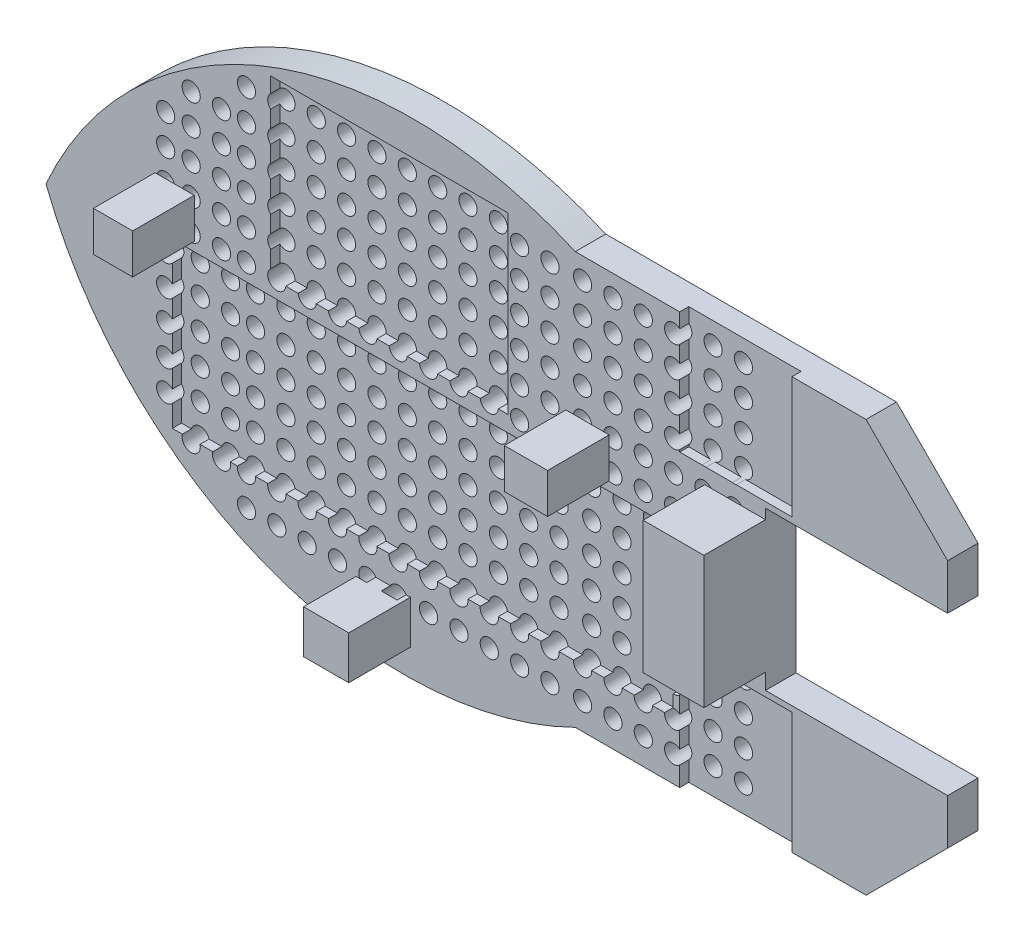
from build123d import *

# Parameters (mm, degrees)
BOSS_EXTRUDE1_DEPTH      = 10
BOSS_EXTRUDE1_DEPTH_BACK = 0.01
SKETCH3_W                = 37
SKETCH3_H                = 40
CUT_EXTRUDE1_DEPTH       = 3
SKETCH5_W                = 37
SKETCH5_H                = 40
CUT_EXTRUDE3_DEPTH       = 3
SKETCH7_W                = 165
SKETCH7_H                = 54
CUT_EXTRUDE4_DEPTH       = 3
SKETCH8_W                = 78.2
SKETCH8_H                = 57.5
CUT_EXTRUDE5_DEPTH       = 3
SKETCH9_W                = 12.924332112
SKETCH9_H                = 13.143388588
SKETCH9_W_2              = 14.238670971
SKETCH9_W_3              = 14.8958404
SKETCH9_H_2              = 14.23867097
BOSS_EXTRUDE2_DEPTH      = 20.3
SKETCH11_R               = 3
CUT_EXTRUDE12_DEPTH      = 13
CUT_EXTRUDE13_REACH      = 254.32
SKETCH12_R               = 3
CUT_EXTRUDE14_REACH      = 254.32
SKETCH13_R               = 3
SKETCH14_R               = 3
CUT_EXTRUDE16_DEPTH      = 10.01
SKETCH15_W               = 20
SKETCH15_H               = 43.5
BOSS_EXTRUDE3_DEPTH      = 20.3


with BuildPart() as part:
    # Sketch1 → Boss-Extrude1 (new, two sides: drawn at the far end of the back side and taken through both)
    with BuildSketch(Plane.XY.offset(-BOSS_EXTRUDE1_DEPTH_BACK)):
        with BuildLine():
            Line((0, 0), (0, 26))
            Line((0, 26), (60, 26))
            Line((60, 26), (60, 41))
            Line((60, 41), (33.129942315, 67.870057685))
            Line((33.129942315, 67.870057685), (-62.646462349, 67.870057685))
            ThreePointArc((-62.646462349, 67.870057685), (-163.893113975, 70.05043462), (-237.027067228, 0))
            ThreePointArc((-237.027067228, 0), (-164.807132047, -72.398849072), (-62.646462349, -67.870057685))
            Line((-62.646462349, -67.870057685), (33.129942315, -67.870057685))
            Line((33.129942315, -67.870057685), (60, -41))
            Line((60, -41), (60, -26))
            Line((60, -26), (0, -26))
            Line((0, -26), (0, 0))
        make_face()
    extrude(amount=BOSS_EXTRUDE1_DEPTH + BOSS_EXTRUDE1_DEPTH_BACK)

    # Sketch3 → Cut-Extrude1 (cut)
    with BuildSketch(Plane.XY.offset(10)):
        with Locations((-9.773002586, 47.870057685)):
            Rectangle(SKETCH3_W, SKETCH3_H)
    extrude(amount=-CUT_EXTRUDE1_DEPTH, mode=Mode.SUBTRACT)

    # Sketch5 → Cut-Extrude3 (cut)
    with BuildSketch(Plane.XY.offset(10)):
        with Locations((-9.773002586, -47.870057685)):
            Rectangle(SKETCH5_W, SKETCH5_H)
    extrude(amount=-CUT_EXTRUDE3_DEPTH, mode=Mode.SUBTRACT)

    # Sketch7 → Cut-Extrude4 (cut)
    with BuildSketch(Plane.XY.offset(10)):
        with Locations((-112.913094129, -21.943838981)):
            Rectangle(SKETCH7_W, SKETCH7_H)
    extrude(amount=-CUT_EXTRUDE4_DEPTH, mode=Mode.SUBTRACT)

    # Sketch8 → Cut-Extrude5 (cut)
    with BuildSketch(Plane.XY.offset(10)):
        with Locations((-123.892735612, 39.063262975)):
            Rectangle(SKETCH8_W, SKETCH8_H)
    extrude(amount=-CUT_EXTRUDE5_DEPTH, mode=Mode.SUBTRACT)

    # Sketch9 → Boss-Extrude2 (add)
    with BuildSketch(Plane.XY.offset(10)):
        with Locations((-194.646396461, 14.582539194)):
            Rectangle(SKETCH9_W, SKETCH9_H)
        with Locations((-58.612324577, 14.582539194)):
            Rectangle(SKETCH9_W_2, SKETCH9_H)
        with Locations((-124.438795754, -65.044490001)):
            Rectangle(SKETCH9_W_3, SKETCH9_H_2)
    extrude(amount=BOSS_EXTRUDE2_DEPTH)

    # Sketch11 → Cut-Extrude12 (cut)
    with BuildSketch(Plane(origin=(0, 0, -0.01), x_dir=(-1, 0, 0), z_dir=(0, 0, -1))):
        with Locations((70.989015497, 60.584399251)):
            Circle(SKETCH11_R)
        with Locations((80.989015497, 60.584399251)):
            Circle(SKETCH11_R)
        with Locations((90.989015497, 60.584399251)):
            Circle(SKETCH11_R)
        with Locations((100.989015497, 60.584399251)):
            Circle(SKETCH11_R)
        with Locations((110.989015497, 60.584399251)):
            Circle(SKETCH11_R)
        with Locations((120.989015497, 60.584399251)):
            Circle(SKETCH11_R)
        with Locations((130.989015497, 60.584399251)):
            Circle(SKETCH11_R)
        with Locations((140.989015497, 60.584399251)):
            Circle(SKETCH11_R)
        with Locations((150.989015497, 60.584399251)):
            Circle(SKETCH11_R)
        with Locations((160.989015497, 60.584399251)):
            Circle(SKETCH11_R)
        with Locations((170.989015497, 60.584399251)):
            Circle(SKETCH11_R)
        with Locations((80.989015497, 50.584399251)):
            Circle(SKETCH11_R)
        with Locations((90.989015497, 50.584399251)):
            Circle(SKETCH11_R)
        with Locations((100.989015497, 50.584399251)):
            Circle(SKETCH11_R)
        with Locations((110.989015497, 50.584399251)):
            Circle(SKETCH11_R)
        with Locations((120.989015497, 50.584399251)):
            Circle(SKETCH11_R)
        with Locations((130.989015497, 50.584399251)):
            Circle(SKETCH11_R)
        with Locations((140.989015497, 50.584399251)):
            Circle(SKETCH11_R)
        with Locations((150.989015497, 50.584399251)):
            Circle(SKETCH11_R)
        with Locations((160.989015497, 50.584399251)):
            Circle(SKETCH11_R)
        with Locations((170.989015497, 50.584399251)):
            Circle(SKETCH11_R)
        with Locations((80.989015497, 40.584399251)):
            Circle(SKETCH11_R)
        with Locations((90.989015497, 40.584399251)):
            Circle(SKETCH11_R)
        with Locations((100.989015497, 40.584399251)):
            Circle(SKETCH11_R)
        with Locations((110.989015497, 40.584399251)):
            Circle(SKETCH11_R)
        with Locations((120.989015497, 40.584399251)):
            Circle(SKETCH11_R)
        with Locations((130.989015497, 40.584399251)):
            Circle(SKETCH11_R)
        with Locations((140.989015497, 40.584399251)):
            Circle(SKETCH11_R)
        with Locations((150.989015497, 40.584399251)):
            Circle(SKETCH11_R)
        with Locations((160.989015497, 40.584399251)):
            Circle(SKETCH11_R)
        with Locations((170.989015497, 40.584399251)):
            Circle(SKETCH11_R)
        with Locations((80.989015497, 30.584399251)):
            Circle(SKETCH11_R)
        with Locations((90.989015497, 30.584399251)):
            Circle(SKETCH11_R)
        with Locations((100.989015497, 30.584399251)):
            Circle(SKETCH11_R)
        with Locations((110.989015497, 30.584399251)):
            Circle(SKETCH11_R)
        with Locations((120.989015497, 30.584399251)):
            Circle(SKETCH11_R)
        with Locations((130.989015497, 30.584399251)):
            Circle(SKETCH11_R)
        with Locations((140.989015497, 30.584399251)):
            Circle(SKETCH11_R)
        with Locations((150.989015497, 30.584399251)):
            Circle(SKETCH11_R)
        with Locations((160.989015497, 30.584399251)):
            Circle(SKETCH11_R)
        with Locations((170.989015497, 30.584399251)):
            Circle(SKETCH11_R)
        with Locations((80.989015497, 20.584399251)):
            Circle(SKETCH11_R)
        with Locations((90.989015497, 20.584399251)):
            Circle(SKETCH11_R)
        with Locations((100.989015497, 20.584399251)):
            Circle(SKETCH11_R)
        with Locations((110.989015497, 20.584399251)):
            Circle(SKETCH11_R)
        with Locations((120.989015497, 20.584399251)):
            Circle(SKETCH11_R)
        with Locations((130.989015497, 20.584399251)):
            Circle(SKETCH11_R)
        with Locations((140.989015497, 20.584399251)):
            Circle(SKETCH11_R)
        with Locations((150.989015497, 20.584399251)):
            Circle(SKETCH11_R)
        with Locations((160.989015497, 20.584399251)):
            Circle(SKETCH11_R)
        with Locations((170.989015497, 20.584399251)):
            Circle(SKETCH11_R)
        with Locations((80.989015497, 10.584399251)):
            Circle(SKETCH11_R)
        with Locations((90.989015497, 10.584399251)):
            Circle(SKETCH11_R)
        with Locations((100.989015497, 10.584399251)):
            Circle(SKETCH11_R)
        with Locations((110.989015497, 10.584399251)):
            Circle(SKETCH11_R)
        with Locations((120.989015497, 10.584399251)):
            Circle(SKETCH11_R)
        with Locations((130.989015497, 10.584399251)):
            Circle(SKETCH11_R)
        with Locations((140.989015497, 10.584399251)):
            Circle(SKETCH11_R)
        with Locations((150.989015497, 10.584399251)):
            Circle(SKETCH11_R)
        with Locations((160.989015497, 10.584399251)):
            Circle(SKETCH11_R)
        with Locations((170.989015497, 10.584399251)):
            Circle(SKETCH11_R)
        with Locations((80.989015497, 0.584399251)):
            Circle(SKETCH11_R)
        with Locations((90.989015497, 0.584399251)):
            Circle(SKETCH11_R)
        with Locations((100.989015497, 0.584399251)):
            Circle(SKETCH11_R)
        with Locations((110.989015497, 0.584399251)):
            Circle(SKETCH11_R)
        with Locations((120.989015497, 0.584399251)):
            Circle(SKETCH11_R)
        with Locations((130.989015497, 0.584399251)):
            Circle(SKETCH11_R)
        with Locations((140.989015497, 0.584399251)):
            Circle(SKETCH11_R)
        with Locations((150.989015497, 0.584399251)):
            Circle(SKETCH11_R)
        with Locations((160.989015497, 0.584399251)):
            Circle(SKETCH11_R)
        with Locations((170.989015497, 0.584399251)):
            Circle(SKETCH11_R)
        with Locations((80.989015497, -9.415600749)):
            Circle(SKETCH11_R)
        with Locations((90.989015497, -9.415600749)):
            Circle(SKETCH11_R)
        with Locations((100.989015497, -9.415600749)):
            Circle(SKETCH11_R)
        with Locations((110.989015497, -9.415600749)):
            Circle(SKETCH11_R)
        with Locations((120.989015497, -9.415600749)):
            Circle(SKETCH11_R)
        with Locations((130.989015497, -9.415600749)):
            Circle(SKETCH11_R)
        with Locations((140.989015497, -9.415600749)):
            Circle(SKETCH11_R)
        with Locations((150.989015497, -9.415600749)):
            Circle(SKETCH11_R)
        with Locations((160.989015497, -9.415600749)):
            Circle(SKETCH11_R)
        with Locations((170.989015497, -9.415600749)):
            Circle(SKETCH11_R)
        with Locations((80.989015497, -19.415600749)):
            Circle(SKETCH11_R)
        with Locations((90.989015497, -19.415600749)):
            Circle(SKETCH11_R)
        with Locations((100.989015497, -19.415600749)):
            Circle(SKETCH11_R)
        with Locations((110.989015497, -19.415600749)):
            Circle(SKETCH11_R)
        with Locations((120.989015497, -19.415600749)):
            Circle(SKETCH11_R)
        with Locations((130.989015497, -19.415600749)):
            Circle(SKETCH11_R)
        with Locations((140.989015497, -19.415600749)):
            Circle(SKETCH11_R)
        with Locations((150.989015497, -19.415600749)):
            Circle(SKETCH11_R)
        with Locations((160.989015497, -19.415600749)):
            Circle(SKETCH11_R)
        with Locations((170.989015497, -19.415600749)):
            Circle(SKETCH11_R)
        with Locations((80.989015497, -29.415600749)):
            Circle(SKETCH11_R)
        with Locations((90.989015497, -29.415600749)):
            Circle(SKETCH11_R)
        with Locations((100.989015497, -29.415600749)):
            Circle(SKETCH11_R)
        with Locations((110.989015497, -29.415600749)):
            Circle(SKETCH11_R)
        with Locations((120.989015497, -29.415600749)):
            Circle(SKETCH11_R)
        with Locations((130.989015497, -29.415600749)):
            Circle(SKETCH11_R)
        with Locations((140.989015497, -29.415600749)):
            Circle(SKETCH11_R)
        with Locations((150.989015497, -29.415600749)):
            Circle(SKETCH11_R)
        with Locations((160.989015497, -29.415600749)):
            Circle(SKETCH11_R)
        with Locations((170.989015497, -29.415600749)):
            Circle(SKETCH11_R)
        with Locations((80.989015497, -39.415600749)):
            Circle(SKETCH11_R)
        with Locations((90.989015497, -39.415600749)):
            Circle(SKETCH11_R)
        with Locations((100.989015497, -39.415600749)):
            Circle(SKETCH11_R)
        with Locations((110.989015497, -39.415600749)):
            Circle(SKETCH11_R)
        with Locations((120.989015497, -39.415600749)):
            Circle(SKETCH11_R)
        with Locations((130.989015497, -39.415600749)):
            Circle(SKETCH11_R)
        with Locations((140.989015497, -39.415600749)):
            Circle(SKETCH11_R)
        with Locations((150.989015497, -39.415600749)):
            Circle(SKETCH11_R)
        with Locations((160.989015497, -39.415600749)):
            Circle(SKETCH11_R)
        with Locations((170.989015497, -39.415600749)):
            Circle(SKETCH11_R)
        with Locations((80.989015497, -49.415600749)):
            Circle(SKETCH11_R)
        with Locations((90.989015497, -49.415600749)):
            Circle(SKETCH11_R)
        with Locations((100.989015497, -49.415600749)):
            Circle(SKETCH11_R)
        with Locations((110.989015497, -49.415600749)):
            Circle(SKETCH11_R)
        with Locations((120.989015497, -49.415600749)):
            Circle(SKETCH11_R)
        with Locations((130.989015497, -49.415600749)):
            Circle(SKETCH11_R)
        with Locations((140.989015497, -49.415600749)):
            Circle(SKETCH11_R)
        with Locations((150.989015497, -49.415600749)):
            Circle(SKETCH11_R)
        with Locations((160.989015497, -49.415600749)):
            Circle(SKETCH11_R)
        with Locations((170.989015497, -49.415600749)):
            Circle(SKETCH11_R)
        with Locations((80.989015497, -59.415600749)):
            Circle(SKETCH11_R)
        with Locations((90.989015497, -59.415600749)):
            Circle(SKETCH11_R)
        with Locations((100.989015497, -59.415600749)):
            Circle(SKETCH11_R)
        with Locations((110.989015497, -59.415600749)):
            Circle(SKETCH11_R)
        with Locations((120.989015497, -59.415600749)):
            Circle(SKETCH11_R)
        with Locations((130.989015497, -59.415600749)):
            Circle(SKETCH11_R)
        with Locations((140.989015497, -59.415600749)):
            Circle(SKETCH11_R)
        with Locations((150.989015497, -59.415600749)):
            Circle(SKETCH11_R)
        with Locations((160.989015497, -59.415600749)):
            Circle(SKETCH11_R)
        with Locations((170.989015497, -59.415600749)):
            Circle(SKETCH11_R)
        with Locations((70.989015497, 50.584399251)):
            Circle(SKETCH11_R)
        with Locations((70.989015497, 40.584399251)):
            Circle(SKETCH11_R)
        with Locations((70.989015497, 30.584399251)):
            Circle(SKETCH11_R)
        with Locations((70.989015497, 20.584399251)):
            Circle(SKETCH11_R)
        with Locations((70.989015497, 10.584399251)):
            Circle(SKETCH11_R)
        with Locations((70.989015497, 0.584399251)):
            Circle(SKETCH11_R)
        with Locations((70.989015497, -9.415600749)):
            Circle(SKETCH11_R)
        with Locations((70.989015497, -19.415600749)):
            Circle(SKETCH11_R)
        with Locations((70.989015497, -29.415600749)):
            Circle(SKETCH11_R)
        with Locations((70.989015497, -39.415600749)):
            Circle(SKETCH11_R)
        with Locations((70.989015497, -49.415600749)):
            Circle(SKETCH11_R)
        with Locations((70.989015497, -59.415600749)):
            Circle(SKETCH11_R)
    extrude(amount=-CUT_EXTRUDE12_DEPTH, mode=Mode.SUBTRACT)

    # Cut-Extrude13: up to this face of the body (flat: up to its plane)
    cut_extrude13_end = Plane(part.part.faces().sort_by_distance((-45.459732468, 64.495853875, 10))[0])
    # Sketch12 → Cut-Extrude13 (cut, up to the picked face)
    with BuildSketch(Plane(origin=(0, 0, -0.01), x_dir=(-1, 0, 0), z_dir=(0, 0, -1)), mode=Mode.PRIVATE) as cut_extrude13_sk1:
        with Locations((179.20291487, 50.26025315)):
            Circle(SKETCH12_R)
    cut_extrude13_tool1 = split(extrude(cut_extrude13_sk1.sketch, amount=-CUT_EXTRUDE13_REACH, mode=Mode.PRIVATE), bisect_by=cut_extrude13_end, keep=Keep.BOTH, mode=Mode.PRIVATE)
    # Sketch12 → Cut-Extrude13 (cut, up to the picked face)
    with BuildSketch(Plane(origin=(0, 0, -0.01), x_dir=(-1, 0, 0), z_dir=(0, 0, -1)), mode=Mode.PRIVATE) as cut_extrude13_sk2:
        with Locations((189.20291487, 50.26025315)):
            Circle(SKETCH12_R)
    cut_extrude13_tool2 = split(extrude(cut_extrude13_sk2.sketch, amount=-CUT_EXTRUDE13_REACH, mode=Mode.PRIVATE), bisect_by=cut_extrude13_end, keep=Keep.BOTH, mode=Mode.PRIVATE)
    # Sketch12 → Cut-Extrude13 (cut, up to the picked face)
    with BuildSketch(Plane(origin=(0, 0, -0.01), x_dir=(-1, 0, 0), z_dir=(0, 0, -1)), mode=Mode.PRIVATE) as cut_extrude13_sk3:
        with Locations((189.20291487, 40.26025315)):
            Circle(SKETCH12_R)
    cut_extrude13_tool3 = split(extrude(cut_extrude13_sk3.sketch, amount=-CUT_EXTRUDE13_REACH, mode=Mode.PRIVATE), bisect_by=cut_extrude13_end, keep=Keep.BOTH, mode=Mode.PRIVATE)
    # Sketch12 → Cut-Extrude13 (cut, up to the picked face)
    with BuildSketch(Plane(origin=(0, 0, -0.01), x_dir=(-1, 0, 0), z_dir=(0, 0, -1)), mode=Mode.PRIVATE) as cut_extrude13_sk4:
        with Locations((189.20291487, 30.26025315)):
            Circle(SKETCH12_R)
    cut_extrude13_tool4 = split(extrude(cut_extrude13_sk4.sketch, amount=-CUT_EXTRUDE13_REACH, mode=Mode.PRIVATE), bisect_by=cut_extrude13_end, keep=Keep.BOTH, mode=Mode.PRIVATE)
    # Sketch12 → Cut-Extrude13 (cut, up to the picked face)
    with BuildSketch(Plane(origin=(0, 0, -0.01), x_dir=(-1, 0, 0), z_dir=(0, 0, -1)), mode=Mode.PRIVATE) as cut_extrude13_sk5:
        with Locations((189.20291487, 20.26025315)):
            Circle(SKETCH12_R)
    cut_extrude13_tool5 = split(extrude(cut_extrude13_sk5.sketch, amount=-CUT_EXTRUDE13_REACH, mode=Mode.PRIVATE), bisect_by=cut_extrude13_end, keep=Keep.BOTH, mode=Mode.PRIVATE)
    # Sketch12 → Cut-Extrude13 (cut, up to the picked face)
    with BuildSketch(Plane(origin=(0, 0, -0.01), x_dir=(-1, 0, 0), z_dir=(0, 0, -1)), mode=Mode.PRIVATE) as cut_extrude13_sk6:
        with Locations((189.20291487, 10.26025315)):
            Circle(SKETCH12_R)
    cut_extrude13_tool6 = split(extrude(cut_extrude13_sk6.sketch, amount=-CUT_EXTRUDE13_REACH, mode=Mode.PRIVATE), bisect_by=cut_extrude13_end, keep=Keep.BOTH, mode=Mode.PRIVATE)
    # Sketch12 → Cut-Extrude13 (cut, up to the picked face)
    with BuildSketch(Plane(origin=(0, 0, -0.01), x_dir=(-1, 0, 0), z_dir=(0, 0, -1)), mode=Mode.PRIVATE) as cut_extrude13_sk7:
        with Locations((189.20291487, 0.26025315)):
            Circle(SKETCH12_R)
    cut_extrude13_tool7 = split(extrude(cut_extrude13_sk7.sketch, amount=-CUT_EXTRUDE13_REACH, mode=Mode.PRIVATE), bisect_by=cut_extrude13_end, keep=Keep.BOTH, mode=Mode.PRIVATE)
    # Sketch12 → Cut-Extrude13 (cut, up to the picked face)
    with BuildSketch(Plane(origin=(0, 0, -0.01), x_dir=(-1, 0, 0), z_dir=(0, 0, -1)), mode=Mode.PRIVATE) as cut_extrude13_sk8:
        with Locations((189.20291487, -9.73974685)):
            Circle(SKETCH12_R)
    cut_extrude13_tool8 = split(extrude(cut_extrude13_sk8.sketch, amount=-CUT_EXTRUDE13_REACH, mode=Mode.PRIVATE), bisect_by=cut_extrude13_end, keep=Keep.BOTH, mode=Mode.PRIVATE)
    # Sketch12 → Cut-Extrude13 (cut, up to the picked face)
    with BuildSketch(Plane(origin=(0, 0, -0.01), x_dir=(-1, 0, 0), z_dir=(0, 0, -1)), mode=Mode.PRIVATE) as cut_extrude13_sk9:
        with Locations((189.20291487, -19.73974685)):
            Circle(SKETCH12_R)
    cut_extrude13_tool9 = split(extrude(cut_extrude13_sk9.sketch, amount=-CUT_EXTRUDE13_REACH, mode=Mode.PRIVATE), bisect_by=cut_extrude13_end, keep=Keep.BOTH, mode=Mode.PRIVATE)
    # Sketch12 → Cut-Extrude13 (cut, up to the picked face)
    with BuildSketch(Plane(origin=(0, 0, -0.01), x_dir=(-1, 0, 0), z_dir=(0, 0, -1)), mode=Mode.PRIVATE) as cut_extrude13_sk10:
        with Locations((189.20291487, -29.73974685)):
            Circle(SKETCH12_R)
    cut_extrude13_tool10 = split(extrude(cut_extrude13_sk10.sketch, amount=-CUT_EXTRUDE13_REACH, mode=Mode.PRIVATE), bisect_by=cut_extrude13_end, keep=Keep.BOTH, mode=Mode.PRIVATE)
    # Sketch12 → Cut-Extrude13 (cut, up to the picked face)
    with BuildSketch(Plane(origin=(0, 0, -0.01), x_dir=(-1, 0, 0), z_dir=(0, 0, -1)), mode=Mode.PRIVATE) as cut_extrude13_sk11:
        with Locations((189.20291487, -39.73974685)):
            Circle(SKETCH12_R)
    cut_extrude13_tool11 = split(extrude(cut_extrude13_sk11.sketch, amount=-CUT_EXTRUDE13_REACH, mode=Mode.PRIVATE), bisect_by=cut_extrude13_end, keep=Keep.BOTH, mode=Mode.PRIVATE)
    # Sketch12 → Cut-Extrude13 (cut, up to the picked face)
    with BuildSketch(Plane(origin=(0, 0, -0.01), x_dir=(-1, 0, 0), z_dir=(0, 0, -1)), mode=Mode.PRIVATE) as cut_extrude13_sk12:
        with Locations((189.20291487, -49.73974685)):
            Circle(SKETCH12_R)
    cut_extrude13_tool12 = split(extrude(cut_extrude13_sk12.sketch, amount=-CUT_EXTRUDE13_REACH, mode=Mode.PRIVATE), bisect_by=cut_extrude13_end, keep=Keep.BOTH, mode=Mode.PRIVATE)
    # Sketch12 → Cut-Extrude13 (cut, up to the picked face)
    with BuildSketch(Plane(origin=(0, 0, -0.01), x_dir=(-1, 0, 0), z_dir=(0, 0, -1)), mode=Mode.PRIVATE) as cut_extrude13_sk13:
        with Locations((179.20291487, 40.26025315)):
            Circle(SKETCH12_R)
    cut_extrude13_tool13 = split(extrude(cut_extrude13_sk13.sketch, amount=-CUT_EXTRUDE13_REACH, mode=Mode.PRIVATE), bisect_by=cut_extrude13_end, keep=Keep.BOTH, mode=Mode.PRIVATE)
    # Sketch12 → Cut-Extrude13 (cut, up to the picked face)
    with BuildSketch(Plane(origin=(0, 0, -0.01), x_dir=(-1, 0, 0), z_dir=(0, 0, -1)), mode=Mode.PRIVATE) as cut_extrude13_sk14:
        with Locations((179.20291487, 30.26025315)):
            Circle(SKETCH12_R)
    cut_extrude13_tool14 = split(extrude(cut_extrude13_sk14.sketch, amount=-CUT_EXTRUDE13_REACH, mode=Mode.PRIVATE), bisect_by=cut_extrude13_end, keep=Keep.BOTH, mode=Mode.PRIVATE)
    # Sketch12 → Cut-Extrude13 (cut, up to the picked face)
    with BuildSketch(Plane(origin=(0, 0, -0.01), x_dir=(-1, 0, 0), z_dir=(0, 0, -1)), mode=Mode.PRIVATE) as cut_extrude13_sk15:
        with Locations((179.20291487, 20.26025315)):
            Circle(SKETCH12_R)
    cut_extrude13_tool15 = split(extrude(cut_extrude13_sk15.sketch, amount=-CUT_EXTRUDE13_REACH, mode=Mode.PRIVATE), bisect_by=cut_extrude13_end, keep=Keep.BOTH, mode=Mode.PRIVATE)
    # Sketch12 → Cut-Extrude13 (cut, up to the picked face)
    with BuildSketch(Plane(origin=(0, 0, -0.01), x_dir=(-1, 0, 0), z_dir=(0, 0, -1)), mode=Mode.PRIVATE) as cut_extrude13_sk16:
        with Locations((179.20291487, 10.26025315)):
            Circle(SKETCH12_R)
    cut_extrude13_tool16 = split(extrude(cut_extrude13_sk16.sketch, amount=-CUT_EXTRUDE13_REACH, mode=Mode.PRIVATE), bisect_by=cut_extrude13_end, keep=Keep.BOTH, mode=Mode.PRIVATE)
    # Sketch12 → Cut-Extrude13 (cut, up to the picked face)
    with BuildSketch(Plane(origin=(0, 0, -0.01), x_dir=(-1, 0, 0), z_dir=(0, 0, -1)), mode=Mode.PRIVATE) as cut_extrude13_sk17:
        with Locations((179.20291487, 0.26025315)):
            Circle(SKETCH12_R)
    cut_extrude13_tool17 = split(extrude(cut_extrude13_sk17.sketch, amount=-CUT_EXTRUDE13_REACH, mode=Mode.PRIVATE), bisect_by=cut_extrude13_end, keep=Keep.BOTH, mode=Mode.PRIVATE)
    # Sketch12 → Cut-Extrude13 (cut, up to the picked face)
    with BuildSketch(Plane(origin=(0, 0, -0.01), x_dir=(-1, 0, 0), z_dir=(0, 0, -1)), mode=Mode.PRIVATE) as cut_extrude13_sk18:
        with Locations((179.20291487, -9.73974685)):
            Circle(SKETCH12_R)
    cut_extrude13_tool18 = split(extrude(cut_extrude13_sk18.sketch, amount=-CUT_EXTRUDE13_REACH, mode=Mode.PRIVATE), bisect_by=cut_extrude13_end, keep=Keep.BOTH, mode=Mode.PRIVATE)
    # Sketch12 → Cut-Extrude13 (cut, up to the picked face)
    with BuildSketch(Plane(origin=(0, 0, -0.01), x_dir=(-1, 0, 0), z_dir=(0, 0, -1)), mode=Mode.PRIVATE) as cut_extrude13_sk19:
        with Locations((179.20291487, -19.73974685)):
            Circle(SKETCH12_R)
    cut_extrude13_tool19 = split(extrude(cut_extrude13_sk19.sketch, amount=-CUT_EXTRUDE13_REACH, mode=Mode.PRIVATE), bisect_by=cut_extrude13_end, keep=Keep.BOTH, mode=Mode.PRIVATE)
    # Sketch12 → Cut-Extrude13 (cut, up to the picked face)
    with BuildSketch(Plane(origin=(0, 0, -0.01), x_dir=(-1, 0, 0), z_dir=(0, 0, -1)), mode=Mode.PRIVATE) as cut_extrude13_sk20:
        with Locations((179.20291487, -29.73974685)):
            Circle(SKETCH12_R)
    cut_extrude13_tool20 = split(extrude(cut_extrude13_sk20.sketch, amount=-CUT_EXTRUDE13_REACH, mode=Mode.PRIVATE), bisect_by=cut_extrude13_end, keep=Keep.BOTH, mode=Mode.PRIVATE)
    # Sketch12 → Cut-Extrude13 (cut, up to the picked face)
    with BuildSketch(Plane(origin=(0, 0, -0.01), x_dir=(-1, 0, 0), z_dir=(0, 0, -1)), mode=Mode.PRIVATE) as cut_extrude13_sk21:
        with Locations((179.20291487, -39.73974685)):
            Circle(SKETCH12_R)
    cut_extrude13_tool21 = split(extrude(cut_extrude13_sk21.sketch, amount=-CUT_EXTRUDE13_REACH, mode=Mode.PRIVATE), bisect_by=cut_extrude13_end, keep=Keep.BOTH, mode=Mode.PRIVATE)
    # Sketch12 → Cut-Extrude13 (cut, up to the picked face)
    with BuildSketch(Plane(origin=(0, 0, -0.01), x_dir=(-1, 0, 0), z_dir=(0, 0, -1)), mode=Mode.PRIVATE) as cut_extrude13_sk22:
        with Locations((179.20291487, -49.73974685)):
            Circle(SKETCH12_R)
    cut_extrude13_tool22 = split(extrude(cut_extrude13_sk22.sketch, amount=-CUT_EXTRUDE13_REACH, mode=Mode.PRIVATE), bisect_by=cut_extrude13_end, keep=Keep.BOTH, mode=Mode.PRIVATE)
    add(cut_extrude13_tool1.solids().sort_by(Axis((-179.202915, 50.260253, -0.01), (0, 0, 1)))[0], mode=Mode.SUBTRACT)
    add(cut_extrude13_tool2.solids().sort_by(Axis((-189.202915, 50.260253, -0.01), (0, 0, 1)))[0], mode=Mode.SUBTRACT)
    add(cut_extrude13_tool3.solids().sort_by(Axis((-189.202915, 40.260253, -0.01), (0, 0, 1)))[0], mode=Mode.SUBTRACT)
    add(cut_extrude13_tool4.solids().sort_by(Axis((-189.202915, 30.260253, -0.01), (0, 0, 1)))[0], mode=Mode.SUBTRACT)
    add(cut_extrude13_tool5.solids().sort_by(Axis((-189.202915, 20.260253, -0.01), (0, 0, 1)))[0], mode=Mode.SUBTRACT)
    add(cut_extrude13_tool6.solids().sort_by(Axis((-189.202915, 10.260253, -0.01), (0, 0, 1)))[0], mode=Mode.SUBTRACT)
    add(cut_extrude13_tool7.solids().sort_by(Axis((-189.202915, 0.260253, -0.01), (0, 0, 1)))[0], mode=Mode.SUBTRACT)
    add(cut_extrude13_tool8.solids().sort_by(Axis((-189.202915, -9.739747, -0.01), (0, 0, 1)))[0], mode=Mode.SUBTRACT)
    add(cut_extrude13_tool9.solids().sort_by(Axis((-189.202915, -19.739747, -0.01), (0, 0, 1)))[0], mode=Mode.SUBTRACT)
    add(cut_extrude13_tool10.solids().sort_by(Axis((-189.202915, -29.739747, -0.01), (0, 0, 1)))[0], mode=Mode.SUBTRACT)
    add(cut_extrude13_tool11.solids().sort_by(Axis((-189.202915, -39.739747, -0.01), (0, 0, 1)))[0], mode=Mode.SUBTRACT)
    add(cut_extrude13_tool12.solids().sort_by(Axis((-189.202915, -49.739747, -0.01), (0, 0, 1)))[0], mode=Mode.SUBTRACT)
    add(cut_extrude13_tool13.solids().sort_by(Axis((-179.202915, 40.260253, -0.01), (0, 0, 1)))[0], mode=Mode.SUBTRACT)
    add(cut_extrude13_tool14.solids().sort_by(Axis((-179.202915, 30.260253, -0.01), (0, 0, 1)))[0], mode=Mode.SUBTRACT)
    add(cut_extrude13_tool15.solids().sort_by(Axis((-179.202915, 20.260253, -0.01), (0, 0, 1)))[0], mode=Mode.SUBTRACT)
    add(cut_extrude13_tool16.solids().sort_by(Axis((-179.202915, 10.260253, -0.01), (0, 0, 1)))[0], mode=Mode.SUBTRACT)
    add(cut_extrude13_tool17.solids().sort_by(Axis((-179.202915, 0.260253, -0.01), (0, 0, 1)))[0], mode=Mode.SUBTRACT)
    add(cut_extrude13_tool18.solids().sort_by(Axis((-179.202915, -9.739747, -0.01), (0, 0, 1)))[0], mode=Mode.SUBTRACT)
    add(cut_extrude13_tool19.solids().sort_by(Axis((-179.202915, -19.739747, -0.01), (0, 0, 1)))[0], mode=Mode.SUBTRACT)
    add(cut_extrude13_tool20.solids().sort_by(Axis((-179.202915, -29.739747, -0.01), (0, 0, 1)))[0], mode=Mode.SUBTRACT)
    add(cut_extrude13_tool21.solids().sort_by(Axis((-179.202915, -39.739747, -0.01), (0, 0, 1)))[0], mode=Mode.SUBTRACT)
    add(cut_extrude13_tool22.solids().sort_by(Axis((-179.202915, -49.739747, -0.01), (0, 0, 1)))[0], mode=Mode.SUBTRACT)

    # Cut-Extrude14: up to this face of the body (flat: up to its plane)
    cut_extrude14_end = Plane(part.part.faces().sort_by_distance((-45.459732468, 64.495853875, 10))[0])
    # Sketch13 → Cut-Extrude14 (cut, up to the picked face)
    with BuildSketch(Plane(origin=(0, 0, -0.01), x_dir=(-1, 0, 0), z_dir=(0, 0, -1)), mode=Mode.PRIVATE) as cut_extrude14_sk1:
        with Locations((197.603658893, 40.21214694)):
            Circle(SKETCH13_R)
    cut_extrude14_tool1 = split(extrude(cut_extrude14_sk1.sketch, amount=-CUT_EXTRUDE14_REACH, mode=Mode.PRIVATE), bisect_by=cut_extrude14_end, keep=Keep.BOTH, mode=Mode.PRIVATE)
    # Sketch13 → Cut-Extrude14 (cut, up to the picked face)
    with BuildSketch(Plane(origin=(0, 0, -0.01), x_dir=(-1, 0, 0), z_dir=(0, 0, -1)), mode=Mode.PRIVATE) as cut_extrude14_sk2:
        with Locations((197.603658893, 30.21214694)):
            Circle(SKETCH13_R)
    cut_extrude14_tool2 = split(extrude(cut_extrude14_sk2.sketch, amount=-CUT_EXTRUDE14_REACH, mode=Mode.PRIVATE), bisect_by=cut_extrude14_end, keep=Keep.BOTH, mode=Mode.PRIVATE)
    # Sketch13 → Cut-Extrude14 (cut, up to the picked face)
    with BuildSketch(Plane(origin=(0, 0, -0.01), x_dir=(-1, 0, 0), z_dir=(0, 0, -1)), mode=Mode.PRIVATE) as cut_extrude14_sk3:
        with Locations((197.603658893, 20.21214694)):
            Circle(SKETCH13_R)
    cut_extrude14_tool3 = split(extrude(cut_extrude14_sk3.sketch, amount=-CUT_EXTRUDE14_REACH, mode=Mode.PRIVATE), bisect_by=cut_extrude14_end, keep=Keep.BOTH, mode=Mode.PRIVATE)
    # Sketch13 → Cut-Extrude14 (cut, up to the picked face)
    with BuildSketch(Plane(origin=(0, 0, -0.01), x_dir=(-1, 0, 0), z_dir=(0, 0, -1)), mode=Mode.PRIVATE) as cut_extrude14_sk4:
        with Locations((197.603658893, 10.21214694)):
            Circle(SKETCH13_R)
    cut_extrude14_tool4 = split(extrude(cut_extrude14_sk4.sketch, amount=-CUT_EXTRUDE14_REACH, mode=Mode.PRIVATE), bisect_by=cut_extrude14_end, keep=Keep.BOTH, mode=Mode.PRIVATE)
    # Sketch13 → Cut-Extrude14 (cut, up to the picked face)
    with BuildSketch(Plane(origin=(0, 0, -0.01), x_dir=(-1, 0, 0), z_dir=(0, 0, -1)), mode=Mode.PRIVATE) as cut_extrude14_sk5:
        with Locations((197.603658893, 0.21214694)):
            Circle(SKETCH13_R)
    cut_extrude14_tool5 = split(extrude(cut_extrude14_sk5.sketch, amount=-CUT_EXTRUDE14_REACH, mode=Mode.PRIVATE), bisect_by=cut_extrude14_end, keep=Keep.BOTH, mode=Mode.PRIVATE)
    # Sketch13 → Cut-Extrude14 (cut, up to the picked face)
    with BuildSketch(Plane(origin=(0, 0, -0.01), x_dir=(-1, 0, 0), z_dir=(0, 0, -1)), mode=Mode.PRIVATE) as cut_extrude14_sk6:
        with Locations((197.603658893, -9.78785306)):
            Circle(SKETCH13_R)
    cut_extrude14_tool6 = split(extrude(cut_extrude14_sk6.sketch, amount=-CUT_EXTRUDE14_REACH, mode=Mode.PRIVATE), bisect_by=cut_extrude14_end, keep=Keep.BOTH, mode=Mode.PRIVATE)
    # Sketch13 → Cut-Extrude14 (cut, up to the picked face)
    with BuildSketch(Plane(origin=(0, 0, -0.01), x_dir=(-1, 0, 0), z_dir=(0, 0, -1)), mode=Mode.PRIVATE) as cut_extrude14_sk7:
        with Locations((197.603658893, -19.78785306)):
            Circle(SKETCH13_R)
    cut_extrude14_tool7 = split(extrude(cut_extrude14_sk7.sketch, amount=-CUT_EXTRUDE14_REACH, mode=Mode.PRIVATE), bisect_by=cut_extrude14_end, keep=Keep.BOTH, mode=Mode.PRIVATE)
    # Sketch13 → Cut-Extrude14 (cut, up to the picked face)
    with BuildSketch(Plane(origin=(0, 0, -0.01), x_dir=(-1, 0, 0), z_dir=(0, 0, -1)), mode=Mode.PRIVATE) as cut_extrude14_sk8:
        with Locations((197.603658893, -29.78785306)):
            Circle(SKETCH13_R)
    cut_extrude14_tool8 = split(extrude(cut_extrude14_sk8.sketch, amount=-CUT_EXTRUDE14_REACH, mode=Mode.PRIVATE), bisect_by=cut_extrude14_end, keep=Keep.BOTH, mode=Mode.PRIVATE)
    # Sketch13 → Cut-Extrude14 (cut, up to the picked face)
    with BuildSketch(Plane(origin=(0, 0, -0.01), x_dir=(-1, 0, 0), z_dir=(0, 0, -1)), mode=Mode.PRIVATE) as cut_extrude14_sk9:
        with Locations((197.603658893, -39.78785306)):
            Circle(SKETCH13_R)
    cut_extrude14_tool9 = split(extrude(cut_extrude14_sk9.sketch, amount=-CUT_EXTRUDE14_REACH, mode=Mode.PRIVATE), bisect_by=cut_extrude14_end, keep=Keep.BOTH, mode=Mode.PRIVATE)
    add(cut_extrude14_tool1.solids().sort_by(Axis((-197.603659, 40.212147, -0.01), (0, 0, 1)))[0], mode=Mode.SUBTRACT)
    add(cut_extrude14_tool2.solids().sort_by(Axis((-197.603659, 30.212147, -0.01), (0, 0, 1)))[0], mode=Mode.SUBTRACT)
    add(cut_extrude14_tool3.solids().sort_by(Axis((-197.603659, 20.212147, -0.01), (0, 0, 1)))[0], mode=Mode.SUBTRACT)
    add(cut_extrude14_tool4.solids().sort_by(Axis((-197.603659, 10.212147, -0.01), (0, 0, 1)))[0], mode=Mode.SUBTRACT)
    add(cut_extrude14_tool5.solids().sort_by(Axis((-197.603659, 0.212147, -0.01), (0, 0, 1)))[0], mode=Mode.SUBTRACT)
    add(cut_extrude14_tool6.solids().sort_by(Axis((-197.603659, -9.787853, -0.01), (0, 0, 1)))[0], mode=Mode.SUBTRACT)
    add(cut_extrude14_tool7.solids().sort_by(Axis((-197.603659, -19.787853, -0.01), (0, 0, 1)))[0], mode=Mode.SUBTRACT)
    add(cut_extrude14_tool8.solids().sort_by(Axis((-197.603659, -29.787853, -0.01), (0, 0, 1)))[0], mode=Mode.SUBTRACT)
    add(cut_extrude14_tool9.solids().sort_by(Axis((-197.603659, -39.787853, -0.01), (0, 0, 1)))[0], mode=Mode.SUBTRACT)

    # Sketch14 → Cut-Extrude16 (cut)
    with BuildSketch(Plane(origin=(0, 0, -0.01), x_dir=(-1, 0, 0), z_dir=(0, 0, -1))):
        with Locations((60.25524815, 60.803455728)):
            Circle(SKETCH14_R)
        with Locations((50.25524815, 60.803455728)):
            Circle(SKETCH14_R)
        with Locations((40.25524815, 60.803455728)):
            Circle(SKETCH14_R)
        with Locations((30.25524815, 60.803455728)):
            Circle(SKETCH14_R)
        with Locations((20.25524815, 60.803455728)):
            Circle(SKETCH14_R)
        with Locations((10.25524815, 60.803455728)):
            Circle(SKETCH14_R)
        with Locations((50.25524815, 50.803455728)):
            Circle(SKETCH14_R)
        with Locations((40.25524815, 50.803455728)):
            Circle(SKETCH14_R)
        with Locations((30.25524815, 50.803455728)):
            Circle(SKETCH14_R)
        with Locations((20.25524815, 50.803455728)):
            Circle(SKETCH14_R)
        with Locations((10.25524815, 50.803455728)):
            Circle(SKETCH14_R)
        with Locations((50.25524815, 40.803455728)):
            Circle(SKETCH14_R)
        with Locations((40.25524815, 40.803455728)):
            Circle(SKETCH14_R)
        with Locations((30.25524815, 40.803455728)):
            Circle(SKETCH14_R)
        with Locations((20.25524815, 40.803455728)):
            Circle(SKETCH14_R)
        with Locations((10.25524815, 40.803455728)):
            Circle(SKETCH14_R)
        with Locations((50.25524815, 30.803455728)):
            Circle(SKETCH14_R)
        with Locations((40.25524815, 30.803455728)):
            Circle(SKETCH14_R)
        with Locations((30.25524815, 30.803455728)):
            Circle(SKETCH14_R)
        with Locations((20.25524815, 30.803455728)):
            Circle(SKETCH14_R)
        with Locations((10.25524815, 30.803455728)):
            Circle(SKETCH14_R)
        with Locations((50.25524815, 20.803455728)):
            Circle(SKETCH14_R)
        with Locations((40.25524815, 20.803455728)):
            Circle(SKETCH14_R)
        with Locations((30.25524815, 20.803455728)):
            Circle(SKETCH14_R)
        with Locations((20.25524815, 20.803455728)):
            Circle(SKETCH14_R)
        with Locations((10.25524815, 20.803455728)):
            Circle(SKETCH14_R)
        with Locations((50.25524815, 10.803455728)):
            Circle(SKETCH14_R)
        with Locations((40.25524815, 10.803455728)):
            Circle(SKETCH14_R)
        with Locations((30.25524815, 10.803455728)):
            Circle(SKETCH14_R)
        with Locations((20.25524815, 10.803455728)):
            Circle(SKETCH14_R)
        with Locations((10.25524815, 10.803455728)):
            Circle(SKETCH14_R)
        with Locations((50.25524815, 0.803455728)):
            Circle(SKETCH14_R)
        with Locations((40.25524815, 0.803455728)):
            Circle(SKETCH14_R)
        with Locations((30.25524815, 0.803455728)):
            Circle(SKETCH14_R)
        with Locations((20.25524815, 0.803455728)):
            Circle(SKETCH14_R)
        with Locations((10.25524815, 0.803455728)):
            Circle(SKETCH14_R)
        with Locations((50.25524815, -9.196544272)):
            Circle(SKETCH14_R)
        with Locations((40.25524815, -9.196544272)):
            Circle(SKETCH14_R)
        with Locations((30.25524815, -9.196544272)):
            Circle(SKETCH14_R)
        with Locations((20.25524815, -9.196544272)):
            Circle(SKETCH14_R)
        with Locations((10.25524815, -9.196544272)):
            Circle(SKETCH14_R)
        with Locations((50.25524815, -19.196544272)):
            Circle(SKETCH14_R)
        with Locations((40.25524815, -19.196544272)):
            Circle(SKETCH14_R)
        with Locations((30.25524815, -19.196544272)):
            Circle(SKETCH14_R)
        with Locations((20.25524815, -19.196544272)):
            Circle(SKETCH14_R)
        with Locations((10.25524815, -19.196544272)):
            Circle(SKETCH14_R)
        with Locations((50.25524815, -29.196544272)):
            Circle(SKETCH14_R)
        with Locations((40.25524815, -29.196544272)):
            Circle(SKETCH14_R)
        with Locations((30.25524815, -29.196544272)):
            Circle(SKETCH14_R)
        with Locations((20.25524815, -29.196544272)):
            Circle(SKETCH14_R)
        with Locations((10.25524815, -29.196544272)):
            Circle(SKETCH14_R)
        with Locations((50.25524815, -39.196544272)):
            Circle(SKETCH14_R)
        with Locations((40.25524815, -39.196544272)):
            Circle(SKETCH14_R)
        with Locations((30.25524815, -39.196544272)):
            Circle(SKETCH14_R)
        with Locations((20.25524815, -39.196544272)):
            Circle(SKETCH14_R)
        with Locations((10.25524815, -39.196544272)):
            Circle(SKETCH14_R)
        with Locations((50.25524815, -49.196544272)):
            Circle(SKETCH14_R)
        with Locations((40.25524815, -49.196544272)):
            Circle(SKETCH14_R)
        with Locations((30.25524815, -49.196544272)):
            Circle(SKETCH14_R)
        with Locations((20.25524815, -49.196544272)):
            Circle(SKETCH14_R)
        with Locations((10.25524815, -49.196544272)):
            Circle(SKETCH14_R)
        with Locations((50.25524815, -59.196544272)):
            Circle(SKETCH14_R)
        with Locations((40.25524815, -59.196544272)):
            Circle(SKETCH14_R)
        with Locations((30.25524815, -59.196544272)):
            Circle(SKETCH14_R)
        with Locations((20.25524815, -59.196544272)):
            Circle(SKETCH14_R)
        with Locations((10.25524815, -59.196544272)):
            Circle(SKETCH14_R)
        with Locations((60.25524815, 50.803455728)):
            Circle(SKETCH14_R)
        with Locations((60.25524815, 40.803455728)):
            Circle(SKETCH14_R)
        with Locations((60.25524815, 30.803455728)):
            Circle(SKETCH14_R)
        with Locations((60.25524815, 20.803455728)):
            Circle(SKETCH14_R)
        with Locations((60.25524815, 10.803455728)):
            Circle(SKETCH14_R)
        with Locations((60.25524815, 0.803455728)):
            Circle(SKETCH14_R)
        with Locations((60.25524815, -9.196544272)):
            Circle(SKETCH14_R)
        with Locations((60.25524815, -19.196544272)):
            Circle(SKETCH14_R)
        with Locations((60.25524815, -29.196544272)):
            Circle(SKETCH14_R)
        with Locations((60.25524815, -39.196544272)):
            Circle(SKETCH14_R)
        with Locations((60.25524815, -49.196544272)):
            Circle(SKETCH14_R)
        with Locations((60.25524815, -59.196544272)):
            Circle(SKETCH14_R)
    extrude(amount=-CUT_EXTRUDE16_DEPTH, mode=Mode.SUBTRACT)

    # Sketch15 → Boss-Extrude3 (add)
    with BuildSketch(Plane.XY.offset(10)):
        with Locations((-10, 0.951564885)):
            Rectangle(SKETCH15_W, SKETCH15_H)
    extrude(amount=BOSS_EXTRUDE3_DEPTH)


solid = part.part
